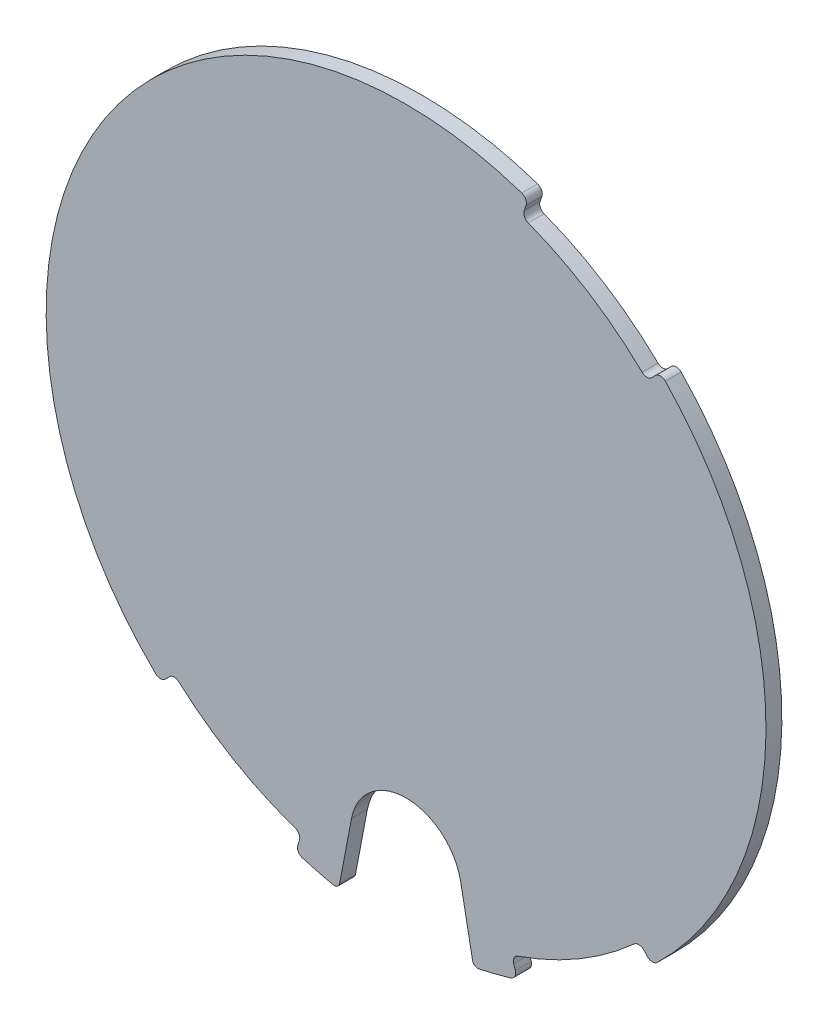
from build123d import *

# Parameters (mm, degrees)
SALIENTE_EXTRUIR2_DEPTH = 1.5
CORTAR_EXTRUIR6_DEPTH   = 1.5
REDONDEO2_R             = 0.65
MATRIZC2_COUNT          = 2
MATRIZC2_ANGLE          = 182
REDONDEO2_OF_MATRIZC2_R = 0.65
MATRIZC3_COUNT          = 2
MATRIZC3_ANGLE          = 243
REDONDEO2_OF_MATRIZC3_R = 0.65


with BuildPart() as part:
    # Croquis3 → Saliente-Extruir2 (new body)
    with BuildSketch(Plane.XY):
        with BuildLine():
            Line((-5.157307796, -27.019308404), (-6.280793024, -32.905285166))
            ThreePointArc((-6.280793024, -32.905285166), (-6.494024336, -33.227196877), (-6.872990522, -33.301219661))
            ThreePointArc((-6.872990522, -33.301219661), (0, 34.003076767), (6.872990522, -33.301219661))
            ThreePointArc((6.872990522, -33.301219661), (6.494024336, -33.227196877), (6.280793024, -32.905285166))
            Line((6.280793024, -32.905285166), (5.157307796, -27.019308404))
            ThreePointArc((5.157307796, -27.019308404), (0, -22.753293006), (-5.157307796, -27.019308404))
        make_face()
    extrude(amount=SALIENTE_EXTRUIR2_DEPTH)

    # Croquis4 → Cortar-Extruir6 (cut)
    with BuildSketch(Plane.XY):
        with BuildLine():
            ThreePointArc((10.940986169, 30.28750526), (17.262989212, 27.1850576), (22.759447155, 22.782574886))
            Line((22.759447155, 22.782574886), (24.031592832, 24.056013293))
            ThreePointArc((24.031592832, 24.056013293), (18.227908832, 28.704574012), (11.552535657, 31.980433854))
            Line((11.552535657, 31.980433854), (10.940986169, 30.28750526))
        make_face()
    cortar_extruir6 = extrude(amount=CORTAR_EXTRUIR6_DEPTH, mode=Mode.SUBTRACT)

    # Redondeo2
    redondeo2_edges = [part.edges().sort_by_distance(p)[0] for p in [
        (11.552535657, 31.980433854, 0.75),
        (24.031592832, 24.056013293, 0.75),
        (22.759447155, 22.782574886, 0.75),
        (10.940986169, 30.28750526, 0.75),
    ]]
    fillet(redondeo2_edges, radius=REDONDEO2_R)

    # MatrizC2: Cortar-Extruir6 ×2 about axis
    matrizc2_axis = Axis((0, 0, -0.075), (0, 0, 1))
    for i in range(1, MATRIZC2_COUNT):
        add(cortar_extruir6.rotate(matrizc2_axis, i * MATRIZC2_ANGLE / (MATRIZC2_COUNT - 1)), mode=Mode.SUBTRACT)

    # Redondeo2 of MatrizC2
    redondeo2_of_matrizc2_edges = [part.edges().sort_by_distance(p)[0] for p in [
        (-10.429397119, -32.364129918, 0.75),
        (-23.177410678, -24.880049515, 0.75),
        (-21.950482318, -23.562989608, 0.75),
        (-9.877302526, -30.650889841, 0.75),
    ]]
    fillet(redondeo2_of_matrizc2_edges, radius=REDONDEO2_OF_MATRIZC2_R)

    # MatrizC3: Cortar-Extruir6 ×2 about axis
    matrizc3_axis = Axis((0, 0, -0.075), (0, 0, 1))
    for i in range(1, MATRIZC3_COUNT):
        add(cortar_extruir6.rotate(matrizc3_axis, i * MATRIZC3_ANGLE / (MATRIZC3_COUNT - 1)), mode=Mode.SUBTRACT)

    # Redondeo2 of MatrizC3
    redondeo2_of_matrizc3_edges = [part.edges().sort_by_distance(p)[0] for p in [
        (23.250033774, -24.812197789, 0.75),
        (10.523949951, -32.333507497, 0.75),
        (9.966850073, -30.62188846, 0.75),
        (22.01926101, -23.498729707, 0.75),
    ]]
    fillet(redondeo2_of_matrizc3_edges, radius=REDONDEO2_OF_MATRIZC3_R)


solid = part.part
